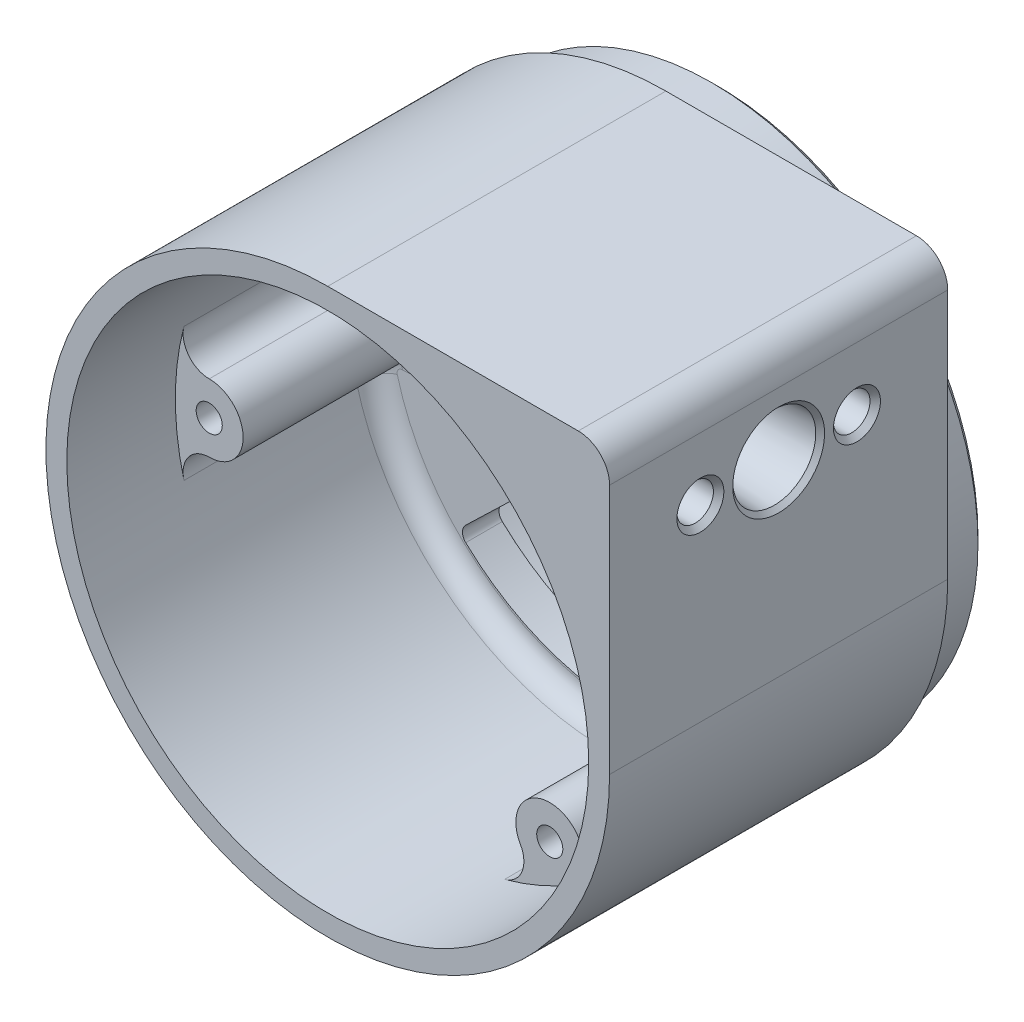
from build123d import *

# Parameters (mm, degrees)
SKETCH1_R           = 27
SKETCH1_R_2         = 7.75
SKETCH1_R_3         = 2.25
BOSS_EXTRUDE1_DEPTH = 28
SKETCH2_R           = 3.75
CUT_EXTRUDE1_DEPTH  = 23.5
BOSS_EXTRUDE2_START = -28
BOSS_EXTRUDE2_DEPTH = 28
SKETCH8_R           = 8.625
CUT_EXTRUDE5_DEPTH  = 2
CHAMFER2_SIZE       = 3.077683537
CHAMFER2_SIZE_2     = 1
SKETCH9_R           = 25
CUT_EXTRUDE6_DEPTH  = 24.5
CUT_EXTRUDE7_DEPTH  = 46.367940222
SKETCH13_R          = 25.5
SKETCH13_R_2        = 24.2
BOSS_EXTRUDE3_DEPTH = 5
FILLET2_R           = 1
CHAMFER3_SIZE       = 0.6
BOSS_EXTRUDE4_START = 18.5
SKETCH14_R          = 1.25
BOSS_EXTRUDE4_DEPTH = 18.5
FILLET4_R           = 2
SKETCH16_R          = 25
BOSS_EXTRUDE5_DEPTH = 4.395
SKETCH6_R           = 4
CUT_EXTRUDE4_DEPTH  = 6
CUT_EXTRUDE4_DRAFT  = -3
FILLET3_R           = 1
SKETCH17_R          = 1.75
CUT_EXTRUDE8_DEPTH  = 5
CHAMFER4_SIZE       = 1
CHAMFER5_SIZE       = 0.5
CHAMFER6_SIZE       = 0.4
CHAMFER6_SIZE2      = 0.422701801


with BuildPart() as part:
    # Sketch1 → Boss-Extrude1 (new body)
    with BuildSketch(Plane.XY):
        Circle(SKETCH1_R)
        Circle(SKETCH1_R_2, mode=Mode.SUBTRACT)
        with Locations((6.25, 10.825317547)):
            Circle(SKETCH1_R_3, mode=Mode.SUBTRACT)
        with Locations((-12.5, 0)):
            Circle(SKETCH1_R_3, mode=Mode.SUBTRACT)
        with Locations((6.25, -10.825317547)):
            Circle(SKETCH1_R_3, mode=Mode.SUBTRACT)
    extrude(amount=BOSS_EXTRUDE1_DEPTH)

    # Sketch2 → Cut-Extrude1 (cut)
    with BuildSketch(Plane.XY.offset(28)):
        with Locations((6.25, 10.825317547)):
            Circle(SKETCH2_R)
        with Locations((6.25, -10.825317547)):
            Circle(SKETCH2_R)
        with Locations((-12.5, 0)):
            Circle(SKETCH2_R)
    extrude(amount=-CUT_EXTRUDE1_DEPTH, mode=Mode.SUBTRACT)

    # Sketch5 → Boss-Extrude2 (add)
    with BuildSketch(Plane.XY.offset(28).offset(BOSS_EXTRUDE2_START)):
        with BuildLine():
            Line((24, 27), (0, 27))
            ThreePointArc((0, 27), (19.091883092, 19.091883092), (27, 0))
            Line((27, 0), (27, 24))
            ThreePointArc((27, 24), (26.121320344, 26.121320344), (24, 27))
        make_face()
    extrude(amount=BOSS_EXTRUDE2_DEPTH)

    # Sketch8 → Cut-Extrude5 (cut)
    with BuildSketch(Plane(origin=(0, 0, 0), x_dir=(-1, 0, 0), z_dir=(0, 0, -1))):
        Circle(SKETCH8_R)
    extrude(amount=-CUT_EXTRUDE5_DEPTH, mode=Mode.SUBTRACT)

    # Chamfer2
    # the kernel refuses this chamfer: 3.077683537, 1 mm, written as the material it takes off along each edge
    with BuildSketch(Plane(origin=(0, 0, 2), x_dir=(1, 0, 0), z_dir=(0, 1, 0))) as chamfer2_piece_1_section:
        Polygon((7.75, -CHAMFER2_SIZE), (7.75 + CHAMFER2_SIZE_2, 0), (7.75, 0), align=None)
    chamfer2_piece_1 = revolve(axis=Axis((0, 0, 2), (0, 0, -1)), mode=Mode.PRIVATE)
    chamfer2_piece_1 = chamfer2_piece_1 & Plane(origin=(0, 0, 3.775868396), x_dir=(-1, 0, 0), z_dir=(0, 0, -1)) * Cylinder(8.625, 35, mode=Mode.PRIVATE)
    add(chamfer2_piece_1, mode=Mode.SUBTRACT)

    # Sketch9 → Cut-Extrude6 (cut)
    with BuildSketch(Plane.XY.offset(28)):
        Circle(SKETCH9_R)
    extrude(amount=-CUT_EXTRUDE6_DEPTH, mode=Mode.SUBTRACT)

    # Sketch11 → Cut-Extrude7 (cut, through all)
    with BuildSketch(Plane.XY.offset(3.5)):
        with BuildLine():
            Line((-3.313412303, 13.358940786), (-5.242503498, 21.136607038))
            ThreePointArc((-5.242503498, 21.136607038), (-5.716794824, 21.764023187), (-6.498098652, 21.854398045))
            ThreePointArc((-6.498098652, 21.854398045), (-15.382889794, 16.828746286), (-21.184335701, 8.429941928))
            ThreePointArc((-21.184335701, 8.429941928), (-21.164322698, 7.643683214), (-20.581922275, 7.115087874))
            Line((-20.581922275, 7.115087874), (-13.008364135, 4.49693924))
            ThreePointArc((-13.008364135, 4.49693924), (-12.277261592, 4.527467244), (-11.762680607, 5.047706898))
            ThreePointArc((-11.762680607, 5.047706898), (-8.636008306, 9.447717213), (-3.97356812, 12.167610957))
            ThreePointArc((-3.97356812, 12.167610957), (-3.409318336, 12.63351338), (-3.313412303, 13.358940786))
        make_face()
        with BuildLine():
            Line((10.398645689, 9.017104182), (16.452807987, 14.266923612))
            ThreePointArc((16.452807987, 14.266923612), (17.201785191, 14.506999504), (17.892711713, 14.131201915))
            ThreePointArc((17.892711713, 14.131201915), (22.265566695, 4.907600202), (22.175513217, -5.299680514))
            ThreePointArc((22.175513217, -5.299680514), (21.706594381, -5.931122048), (20.926090394, -6.02816231))
            Line((20.926090394, -6.02816231), (13.225888239, -3.809971165))
            ThreePointArc((13.225888239, -3.809971165), (12.645602694, -3.364200402), (12.524244252, -2.642594543))
            ThreePointArc((12.524244252, -2.642594543), (12.499967267, 2.755143973), (10.252782708, 7.662926774))
            ThreePointArc((10.252782708, 7.662926774), (10.059532444, 8.368686806), (10.398645689, 9.017104182))
        make_face()
        with BuildLine():
            Line((2.609718446, -13.514043423), (4.129114288, -21.382011486))
            ThreePointArc((4.129114288, -21.382011486), (3.962537507, -22.150682718), (3.291623988, -22.561143843))
            ThreePointArc((3.291623988, -22.561143843), (-6.882676901, -21.736346489), (-15.677414566, -16.554717531))
            ThreePointArc((-15.677414566, -16.554717531), (-15.989799557, -15.832901139), (-15.683586895, -15.108444728))
            Line((-15.683586895, -15.108444728), (-9.912475936, -9.54896962))
            ThreePointArc((-9.912475936, -9.54896962), (-9.236284359, -9.269312979), (-8.550676132, -9.525016414))
            ThreePointArc((-8.550676132, -9.525016414), (-3.863958962, -12.202861187), (1.509897899, -12.710633672))
            ThreePointArc((1.509897899, -12.710633672), (2.217729148, -12.89615405), (2.609718446, -13.514043423))
        make_face()
    extrude(amount=-CUT_EXTRUDE7_DEPTH, mode=Mode.SUBTRACT)

    # Sketch13 → Boss-Extrude3 (add)
    with BuildSketch(Plane(origin=(0, 0, 0), x_dir=(-1, 0, 0), z_dir=(0, 0, -1))):
        with Locations(Location((0, 0, 0), (0, 0, 180))):
            Circle(SKETCH13_R)
        Circle(SKETCH13_R_2, mode=Mode.SUBTRACT)
    extrude(amount=BOSS_EXTRUDE3_DEPTH)

    # Fillet2
    fillet2_edges = [part.edges().sort_by_distance(p)[0] for p in [
        (24.2, 0, 0),
    ]]
    fillet(fillet2_edges, radius=FILLET2_R)

    # Chamfer3
    chamfer3_edges = [part.edges().sort_by_distance(p)[0] for p in [
        (-25.5, 0, -5),
    ]]
    chamfer(chamfer3_edges, length=CHAMFER3_SIZE)

    # Sketch14 → Boss-Extrude4 (add)
    # profile 1 of 3: a face of its own
    with BuildSketch(Plane.XY.offset(3.5).offset(BOSS_EXTRUDE4_START)):
        with BuildLine():
            ThreePointArc((-21.75, 3.25), (-23.732661129, 4.225738777), (-24.16904317, 6.391975612))
            ThreePointArc((-24.16904317, 6.391975612), (-25, 0), (-24.16904317, -6.391975612))
            ThreePointArc((-24.16904317, -6.391975612), (-23.732661129, -4.225738777), (-21.75, -3.25))
            ThreePointArc((-21.75, -3.25), (-18.5, 0), (-21.75, 3.25))
        make_face()
        with Locations((-21.75, 0)):
            Circle(SKETCH14_R, mode=Mode.SUBTRACT)
    # profile 2 of 3: a face of its own
    with BuildSketch(Plane.XY.offset(3.5).offset(BOSS_EXTRUDE4_START)):
        with BuildLine():
            ThreePointArc((13.689582562, 17.211052532), (15.525927695, 18.440218049), (17.620134846, 17.735017565))
            ThreePointArc((17.620134846, 17.735017565), (12.5, 21.650635095), (6.548908325, 24.126993177))
            ThreePointArc((6.548908325, 24.126993177), (8.206733434, 22.665956825), (8.060417438, 20.461052532))
            ThreePointArc((8.060417438, 20.461052532), (9.25, 16.02146997), (13.689582562, 17.211052532))
        make_face()
        with Locations((10.875, 18.836052532)):
            Circle(SKETCH14_R, mode=Mode.SUBTRACT)
    # profile 3 of 3: a face of its own
    with BuildSketch(Plane.XY.offset(3.5).offset(BOSS_EXTRUDE4_START)):
        with BuildLine():
            ThreePointArc((8.060417438, -20.461052532), (8.206733434, -22.665956825), (6.548908325, -24.126993177))
            ThreePointArc((6.548908325, -24.126993177), (12.5, -21.650635095), (17.620134846, -17.735017565))
            ThreePointArc((17.620134846, -17.735017565), (15.525927695, -18.440218049), (13.689582562, -17.211052532))
            ThreePointArc((13.689582562, -17.211052532), (9.25, -16.02146997), (8.060417438, -20.461052532))
        make_face()
        with Locations((10.875, -18.836052532)):
            Circle(SKETCH14_R, mode=Mode.SUBTRACT)
    extrude(amount=-BOSS_EXTRUDE4_DEPTH)

    # Fillet4
    fillet4_edges = [part.edges().sort_by_distance(p)[0] for p in [
        (-12.5, -21.650635095, 3.5),
        (-12.5, 21.650635095, 3.5),
        (23.081414289, -9.604598608, 3.5),
        (-23.732661129, -4.225738777, 3.5),
        (-23.732661129, 4.225738777, 3.5),
        (-18.5, 0, 3.5),
        (8.206733434, 22.665956825, 3.5),
        (15.525927695, 18.440218049, 3.5),
        (9.25, 16.02146997, 3.5),
        (15.525927695, -18.440218049, 3.5),
        (8.206733434, -22.665956825, 3.5),
        (9.25, -16.02146997, 3.5),
    ]]
    fillet(fillet4_edges, radius=FILLET4_R)

    # Sketch16 → Boss-Extrude5 (add)
    with BuildSketch(Plane.XY.offset(28)):
        with BuildLine():
            Line((27, 0), (27, 24))
            ThreePointArc((27, 24), (26.121320344, 26.121320344), (24, 27))
            Line((24, 27), (0, 27))
            ThreePointArc((0, 27), (-19.091883092, -19.091883092), (27, 0))
        make_face()
        Circle(SKETCH16_R, mode=Mode.SUBTRACT)
    extrude(amount=BOSS_EXTRUDE5_DEPTH)


with BuildPart() as cut_extrude4_tool:
    # Sketch6 → Cut-Extrude4 (with draft: the straight prism first)
    with BuildSketch(Plane(origin=(27, 0, 0), x_dir=(0, 0, -1), z_dir=(1, 0, 0))):
        with Locations((-16.1975, 18)):
            Circle(SKETCH6_R)
    extrude(amount=-CUT_EXTRUDE4_DEPTH)
    # Cut-Extrude4: the draft: its side faces are tilted about the plane it starts from
    cut_extrude4_sides = [cut_extrude4_tool.faces().sort_by_distance(p)[0] for p in [
        (24, 18, 20.1975),
    ]]
    draft(cut_extrude4_sides, Plane(origin=(27, 0, 0), x_dir=(0, 0, -1), z_dir=(1, 0, 0)), CUT_EXTRUDE4_DRAFT)


with BuildPart() as part_1:
    add(part.part)

    # Cut-Extrude4: cut by cut_extrude4_tool
    add(cut_extrude4_tool.part, mode=Mode.SUBTRACT)

    # Fillet3
    fillet3_edges = [part_1.edges().sort_by_distance(p)[0] for p in [
        (-25.5, 0, 0),
    ]]
    fillet(fillet3_edges, radius=FILLET3_R)

    # Sketch17 → Cut-Extrude8 (cut)
    with BuildSketch(Plane(origin=(27, 0, 0), x_dir=(0, 0, -1), z_dir=(1, 0, 0))):
        with Locations(Location((-23.6975, 18, 0), (0, 0, 90))):
            Circle(SKETCH17_R)
        with Locations(Location((-8.6975, 18, 0), (0, 0, 90))):
            Circle(SKETCH17_R)
    extrude(amount=-CUT_EXTRUDE8_DEPTH, mode=Mode.SUBTRACT)

    # Chamfer4
    chamfer4_edges = [part_1.edges().sort_by_distance(p)[0] for p in [
        (22, 16.25, 23.6975),
        (22, 16.25, 8.6975),
    ]]
    chamfer(chamfer4_edges, length=CHAMFER4_SIZE)

    # Chamfer5
    chamfer5_edges = [part_1.edges().sort_by_distance(p)[0] for p in [
        (27, 16.25, 23.6975),
        (27, 16.25, 8.6975),
    ]]
    chamfer(chamfer5_edges, length=CHAMFER5_SIZE)

    # Chamfer6
    chamfer6_edges = [part_1.edges().sort_by_distance(p)[0] for p in [
        (27, 18, 20.1975),
    ]]
    chamfer6_side = [part_1.faces().sort_by_distance(p)[0] for p in [
        (27, 11.291860115, 16.1975),
    ]]
    chamfer(chamfer6_edges, length=CHAMFER6_SIZE, length2=CHAMFER6_SIZE2, reference=chamfer6_side[0])


solid = part_1.part
